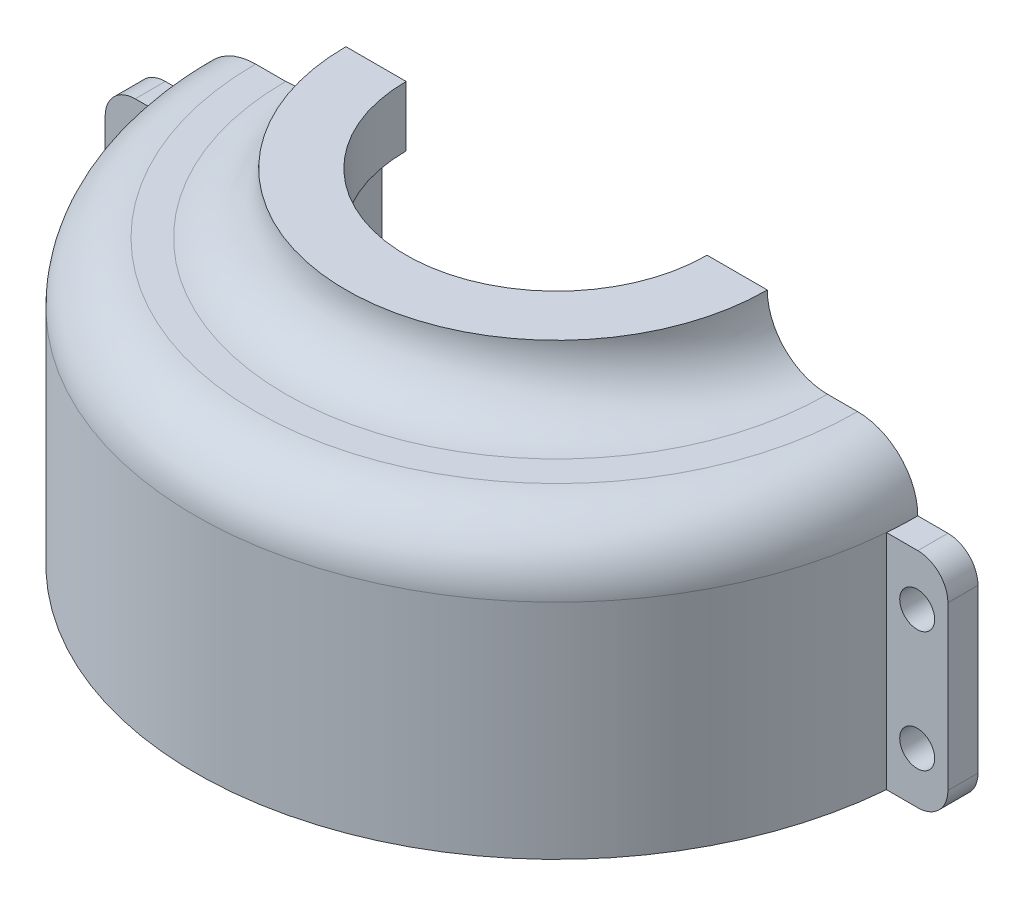
from build123d import *

# Parameters (mm, degrees)
SKETCH1_R                = 25
SKETCH1_R_2              = 20
BOSS_EXTRUDE1_DEPTH      = 5
BOSS_EXTRUDE2_START      = -5
SKETCH2_R                = 60
SKETCH2_R_2              = 20
BOSS_EXTRUDE2_DEPTH      = 5
SKETCH3_R                = 60
SKETCH3_R_2              = 55
BOSS_EXTRUDE3_DEPTH      = 17
SKETCH4_R                = 60
SKETCH4_R_2              = 29
BOSS_EXTRUDE4_DEPTH      = 25
SKETCH5_R                = 35
SKETCH5_R_2              = 25
BOSS_EXTRUDE5_DEPTH      = 10
FILLET2_R                = 10
SKETCH6_W                = 10
SKETCH6_H                = 37
BOSS_EXTRUDE7_DEPTH      = 5
BOSS_EXTRUDE8_REACH      = 156.107
BOSS_EXTRUDE8_END_RADIUS = 60
SKETCH7_W                = 10
SKETCH7_H                = 37
M5_CLEARANCE_HOLE1_D     = 5.8
FILLET3_R                = 5


with BuildPart() as part:
    # Sketch1 → Boss-Extrude1 (new body)
    with BuildSketch(Plane(origin=(0, 0, 0), x_dir=(1, 0, 0), z_dir=(0, 1, 0))):
        with Locations(Location((0, 0, 0), (0, 0, 270))):
            Circle(SKETCH1_R)
        with Locations(Location((0, 0, 0), (0, 0, 270))):
            Circle(SKETCH1_R_2, mode=Mode.SUBTRACT)
    extrude(amount=BOSS_EXTRUDE1_DEPTH)

    # Sketch2 → Boss-Extrude2 (add)
    with BuildSketch(Plane(origin=(0, 5, 0), x_dir=(1, 0, 0), z_dir=(0, 1, 0)).offset(BOSS_EXTRUDE2_START)):
        with Locations(Location((0, 0, 0), (0, 0, 270))):
            Circle(SKETCH2_R)
        with Locations(Location((0, 0, 0), (0, 0, 270))):
            Circle(SKETCH2_R_2, mode=Mode.SUBTRACT)
    extrude(amount=BOSS_EXTRUDE2_DEPTH)

    # Sketch3 → Boss-Extrude3 (add)
    with BuildSketch(Plane(origin=(0, 5, 0), x_dir=(1, 0, 0), z_dir=(0, 1, 0))):
        with Locations(Location((0, 0, 0), (0, 0, 270))):
            Circle(SKETCH3_R)
        with Locations(Location((0, 0, 0), (0, 0, 270))):
            Circle(SKETCH3_R_2, mode=Mode.SUBTRACT)
    extrude(amount=BOSS_EXTRUDE3_DEPTH)

    # Sketch4 → Boss-Extrude4 (add)
    with BuildSketch(Plane(origin=(0, 22, 0), x_dir=(1, 0, 0), z_dir=(0, 1, 0))):
        with Locations(Location((0, 0, 0), (0, 0, 270))):
            Circle(SKETCH4_R)
        with Locations(Location((0, 0, 0), (0, 0, 270))):
            Circle(SKETCH4_R_2, mode=Mode.SUBTRACT)
    extrude(amount=BOSS_EXTRUDE4_DEPTH)

    # Sketch5 → Boss-Extrude5 (add)
    with BuildSketch(Plane(origin=(0, 47, 0), x_dir=(1, 0, 0), z_dir=(0, 1, 0))):
        with Locations(Location((0, 0, 0), (0, 0, 270))):
            Circle(SKETCH5_R)
        with Locations(Location((0, 0, 0), (0, 0, 270))):
            Circle(SKETCH5_R_2, mode=Mode.SUBTRACT)
    extrude(amount=BOSS_EXTRUDE5_DEPTH)

    # Fillet2
    fillet2_edges = [part.edges().sort_by_distance(p)[0] for p in [
        (0, 47, -60),
        (0, 47, -35),
    ]]
    fillet(fillet2_edges, radius=FILLET2_R - 0.0001)  # a hair under: the kernel refuses the full size



with BuildPart() as body_2:
    # Sketch6 → Boss-Extrude7 (new, symmetric)
    with BuildSketch(Plane.XY):
        with Locations((-65, 18.5)):
            Rectangle(SKETCH6_W, SKETCH6_H)
    extrude(amount=BOSS_EXTRUDE7_DEPTH, both=True)


with BuildPart() as part_1:
    add(part.part)

    add(body_2.part)  # Boss-Extrude8 merges body 2
    # Boss-Extrude8: up to this cylinder (the profile starts outside it)
    boss_extrude8_end = Plane(origin=(0, 18.5, 0), z_dir=(0, 1, 0)) * Cylinder(BOSS_EXTRUDE8_END_RADIUS, 433.214, mode=Mode.PRIVATE)
    # Sketch7 → Boss-Extrude8 (add, up to the surface)
    with BuildSketch(Plane.ZY.offset(70), mode=Mode.PRIVATE) as boss_extrude8_sk1:
        with Locations((0, 18.5)):
            Rectangle(SKETCH7_W, SKETCH7_H)
    boss_extrude8_tool1 = extrude(boss_extrude8_sk1.sketch, amount=-BOSS_EXTRUDE8_REACH, mode=Mode.PRIVATE) - boss_extrude8_end
    add(boss_extrude8_tool1.solids().sort_by_distance((-70, 18.5, 0))[0])

    # M5 Clearance Hole1 (through all)
    with Locations(Plane.XY.offset(5)):
        with Locations((-64.895651858, 8.5), (-64.895651858, 28.5)):
            Hole(M5_CLEARANCE_HOLE1_D / 2)

    # Fillet3
    fillet3_edges = [part_1.edges().sort_by_distance(p)[0] for p in [
        (-70, 37, 0),
        (-70, 0, 0),
    ]]
    fillet(fillet3_edges, radius=FILLET3_R)

    # Mirror1: part across plane


with BuildPart() as part_2:
    add(part_1.part)
    add(part_1.part.mirror(Plane(origin=(0, 0, 0), x_dir=(0, 0, 1), z_dir=(1, 0, 0))))


with BuildPart() as body_2_2:
    # Split1: the piece on the far side of the plane
    add(part_2.part)
    split(bisect_by=Plane.XY, keep=Keep.BOTTOM)


with BuildPart() as part_3:
    add(part_2.part)

    # Split1
    split(bisect_by=Plane.XY, keep=Keep.TOP)


solid = part_3.part
